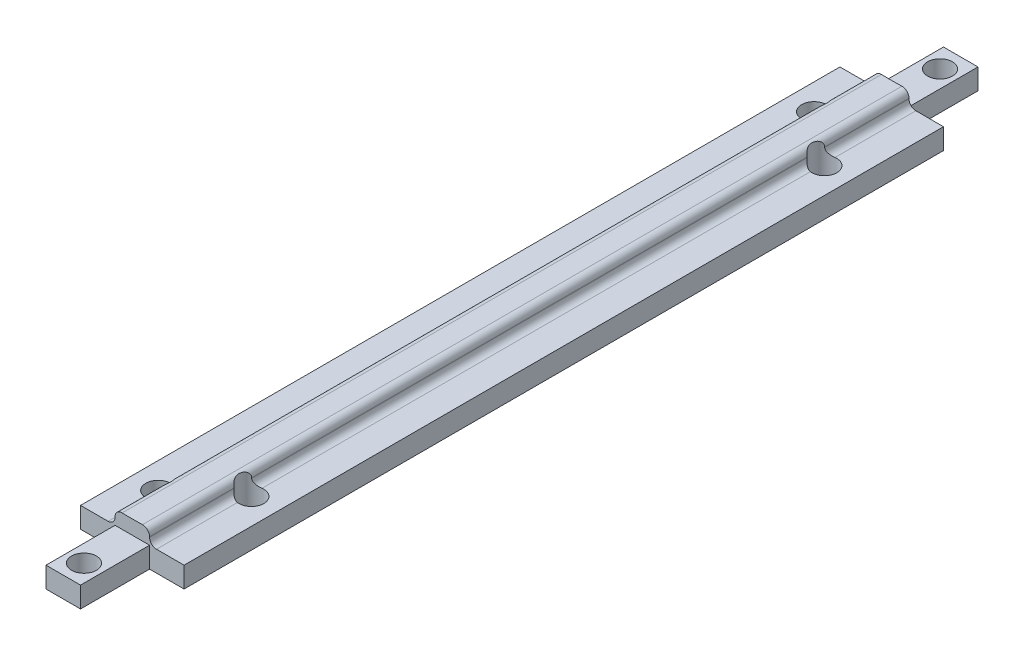
from build123d import *

# Parameters (mm, degrees)
SKETCH1_W               = 5
SKETCH1_H               = 110
BOSS_EXTRUDE1_DEPTH     = 3
BOSS_EXTRUDE2_DEPTH     = 55
BOSS_EXTRUDE3_START     = 55
BOSS_EXTRUDE3_DEPTH     = 55
SKETCH8_W               = 5
SKETCH8_H               = 10
BOSS_EXTRUDE4_DEPTH     = 3
SKETCH6_R               = 1.8
CUT_EXTRUDE1_DEPTH      = 66.117202028
SKETCH9_W               = 15
SKETCH9_H               = 110
BOSS_EXTRUDE5_DEPTH     = 3
FILLET1_R               = 1
CUT_EXTRUDE2_DEPTH      = 66.5
CUT_EXTRUDE2_DEPTH_BACK = 66.5
SKETCH10_R              = 1.8


with BuildPart() as part:
    # Sketch1 → Boss-Extrude1 (new body)
    with BuildSketch(Plane(origin=(0, 0, 0), x_dir=(1, 0, 0), z_dir=(0, 1, 0))):
        Rectangle(SKETCH1_W, SKETCH1_H)
    extrude(amount=BOSS_EXTRUDE1_DEPTH)

    # Sketch3 → Boss-Extrude2 (add)
    with BuildSketch(Plane.XY):
        with BuildLine():
            Line((-2.5, 3), (-2.5, 5.102989898))
            ThreePointArc((-2.5, 5.102989898), (0, 5.05), (2.5, 5.102989898))
            Line((2.5, 5.102989898), (2.5, 3))
            Line((2.5, 3), (2.5, 0))
            Line((2.5, 0), (-2.5, 0))
            Line((-2.5, 0), (-2.5, 3))
        make_face()
    extrude(amount=BOSS_EXTRUDE2_DEPTH)

    # Sketch7 → Boss-Extrude3 (add)
    with BuildSketch(Plane(origin=(0, 0, 0), x_dir=(-1, 0, 0), z_dir=(0, 0, -1)).offset(BOSS_EXTRUDE3_START)):
        with BuildLine():
            Line((-2.5, 5.102989898), (-2.5, 3))
            Line((-2.5, 3), (2.5, 3))
            Line((2.5, 3), (2.5, 5.102989898))
            ThreePointArc((2.5, 5.102989898), (0, 5.05), (-2.5, 5.102989898))
        make_face()
    extrude(amount=-BOSS_EXTRUDE3_DEPTH)

    # Sketch8 → Boss-Extrude4 (add)
    with BuildSketch(Plane.XZ):
        with Locations((0, 60)):
            Rectangle(SKETCH8_W, SKETCH8_H)
        with Locations((0, -60)):
            Rectangle(SKETCH8_W, SKETCH8_H)
    extrude(amount=-BOSS_EXTRUDE4_DEPTH)

    # Sketch6 → Cut-Extrude1 (cut, through all)
    with BuildSketch(Plane(origin=(0, 3, 0), x_dir=(1, 0, 0), z_dir=(0, 1, 0))):
        with Locations(Location((0, -62, 0), (0, 0, 270))):
            Circle(SKETCH6_R)
        with Locations(Location((0, 62, 0), (0, 0, 90))):
            Circle(SKETCH6_R)
    extrude(amount=-CUT_EXTRUDE1_DEPTH, mode=Mode.SUBTRACT)

    # Sketch9 → Boss-Extrude5 (add)
    with BuildSketch(Plane.XZ):
        Rectangle(SKETCH9_W, SKETCH9_H)
    extrude(amount=-BOSS_EXTRUDE5_DEPTH)

    # Fillet1
    # the kernel refuses this fillet: 1 mm, written as the material it adds along each edge
    with BuildSketch(Plane(origin=(2.5, 3, -55), x_dir=(0, 1, 0), z_dir=(0, 0, 1)), Plane(origin=(-2.5, 3, 55), x_dir=(0, 1, 0), z_dir=(0, 0, -1))) as fillet1_piece_1:
        with BuildLine():
            CenterArc((FILLET1_R, -FILLET1_R), FILLET1_R, 90, 90)
            Line((0, -FILLET1_R), (0, 0))
            Line((0, 0), (FILLET1_R, 0))
        make_face()
    extrude(amount=110)
    # the kernel refuses this fillet: 1 mm, written as the material it takes off along each edge
    with BuildSketch(Plane(origin=(-2.5, 5.102989898, 57.585592418), x_dir=(0, -1, 0), z_dir=(0, 0, -1))) as fillet1_2_piece_1:
        with BuildLine():
            CenterArc((1.034236967, -1), FILLET1_R, 90, 91.432543738)
            ThreePointArc((0.034549516, -1.025), (0.019501965, -0.512424928), (0, 0))
            Line((0, 0), (1.034236967, 0))
        make_face()
    extrude(amount=115.171184836, mode=Mode.SUBTRACT)
    with BuildSketch(Plane(origin=(2.5, 5.102989898, 57.585592418), x_dir=(0, -1, 0), z_dir=(0, 0, -1))) as fillet1_2_piece_2:
        with BuildLine():
            CenterArc((1.034236967, 1), FILLET1_R, 178.567456262, 91.432543738)
            ThreePointArc((0.034549516, 1.025), (0.019501965, 0.512424928), (0, 0))
            Line((0, 0), (1.034236967, 0))
        make_face()
    extrude(amount=115.171184836, mode=Mode.SUBTRACT)

    # Sketch10 → Cut-Extrude2 (cut, two sides: drawn at the far end of the back side and taken through both)
    with BuildSketch(Plane(origin=(0, 3, 0), x_dir=(1, 0, 0), z_dir=(0, 1, 0)).offset(-CUT_EXTRUDE2_DEPTH_BACK)):
        with Locations(Location((-3.75, -47.5, 0), (0, 0, 270))):
            Circle(SKETCH10_R)
        with Locations(Location((3.75, -41.5, 0), (0, 0, 270))):
            Circle(SKETCH10_R)
        with Locations(Location((3.75, 41.5, 0), (0, 0, 262.016443854))):
            Circle(SKETCH10_R)
        with Locations(Location((-3.75, 47.5, 0), (0, 0, 277.983556146))):
            Circle(SKETCH10_R)
    extrude(amount=CUT_EXTRUDE2_DEPTH + CUT_EXTRUDE2_DEPTH_BACK, mode=Mode.SUBTRACT)


solid = part.part
